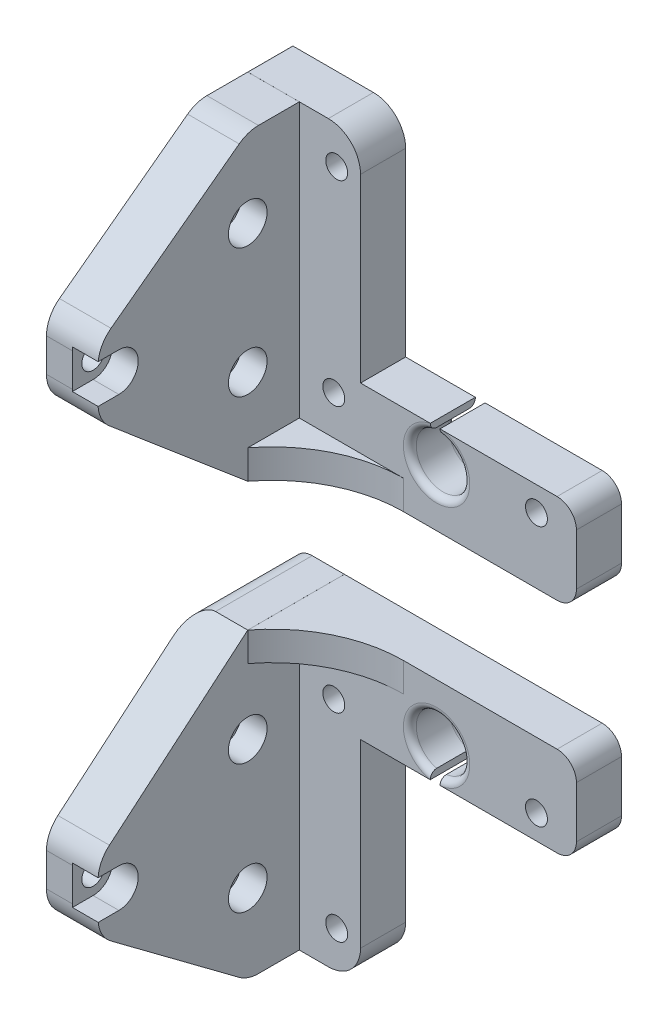
from build123d import *

# Parameters (mm, degrees)
SKETCH50_R         = 1.75
EXTRUDE1_DEPTH     = 8
SKETCH52_R         = 4.15
SKETCH52_R_2       = 1.7
EXTRUDE2_DEPTH     = 7
FILLET1_R          = 3
FILLET2_R          = 5
EXTRUDE3_DEPTH     = 4.5
FILLET4_R          = 5
FILLET5_R          = 3
SKETCH55_R         = 3
CUT_EXTRUDE3_DEPTH = 4
FILLET9_R          = 1
FILLET10_R         = 1
SKETCH57_W         = 1
SKETCH57_H         = 8.155835086
EXTRUDE4_DEPTH     = 4
CUT_EXTRUDE4_START = -7
SKETCH56_W         = 0.996940693
SKETCH56_H         = 2.63977817
CUT_EXTRUDE4_DEPTH = 7.000001


with BuildPart() as part:
    # Sketch50 → Extrude1 (new body)
    with BuildSketch(Plane(origin=(60, 0, 0), x_dir=(0, 0, -1), z_dir=(1, 0, 0))):
        Polygon((-38.234887292, -28), (-38.234887292, -38), (-15, -55.32486375), (0, -55.32486375), (0, -8.32486375), (-15, -8.32486375), align=None)
        with Locations((-35, -33)):
            Circle(SKETCH50_R, mode=Mode.SUBTRACT)
        with Locations((-15, -23)):
            Circle(SKETCH50_R, mode=Mode.SUBTRACT)
        with Locations((-15, -43)):
            Circle(SKETCH50_R, mode=Mode.SUBTRACT)
    extrude(amount=EXTRUDE1_DEPTH)

    # Sketch52 → Extrude2 (add)
    with BuildSketch(Plane(origin=(0, 0, 0), x_dir=(-1, 0, 0), z_dir=(0, 0, -1))):
        Polygon((-60.021067729, -55.328445544), (-60.021067729, -8.328445544), (-111, -8.328445544), (-111, -22.280627193), (-77.5, -22.280627193), (-77.5, -55.328445544), align=None)
        with Locations(Location((-89.299980942, -17.200015896, 0), (0, 0, 90))):
            Circle(SKETCH52_R, mode=Mode.SUBTRACT)
        with Locations(Location((-73.351535893, -18.931266408, 0), (0, 0, 90))):
            Circle(SKETCH52_R_2, mode=Mode.SUBTRACT)
        with Locations(Location((-104.8, -18.5, 0), (0, 0, 90))):
            Circle(SKETCH52_R_2, mode=Mode.SUBTRACT)
        with Locations(Location((-73.801481725, -49.508569042, 0), (0, 0, 90))):
            Circle(SKETCH52_R_2, mode=Mode.SUBTRACT)
    extrude(amount=-EXTRUDE2_DEPTH)

    # Fillet1
    fillet1_edges = [part.edges().sort_by_distance(p)[0] for p in [
        (111, -22.280627193, 3.5),
        (111, -8.328445544, 3.5),
    ]]
    fillet(fillet1_edges, radius=FILLET1_R)

    # Fillet2
    fillet2_edges = [part.edges().sort_by_distance(p)[0] for p in [
        (77.5, -55.328445544, 3.5),
    ]]
    fillet(fillet2_edges, radius=FILLET2_R)

    # Sketch54 → Extrude3 (add)
    with BuildSketch(Plane(origin=(0, -8.328445544, 0), x_dir=(1, 0, 0), z_dir=(0, 1, 0))):
        with BuildLine():
            Line((68, -15), (68, -7))
            Line((68, -7), (84.179453899, -7))
            ThreePointArc((84.179453899, -7), (75.154838555, -9.109252039), (68, -15))
        make_face()
    extrude(amount=-EXTRUDE3_DEPTH)

    # Fillet4
    fillet4_edges = [part.edges().sort_by_distance(p)[0] for p in [
        (64, -55.32486375, 15),
        (64, -38, 38.234887292),
        (64, -28, 38.234887292),
    ]]
    fillet(fillet4_edges, radius=FILLET4_R)

    # Fillet5
    fillet5_edges = [part.edges().sort_by_distance(p)[0] for p in [
        (60, -8.32486375, 7.5),
    ]]
    fillet(fillet5_edges, radius=FILLET5_R)

    # Sketch55 → Cut-Extrude3 (cut)
    with BuildSketch(Plane(origin=(68, 0, 0), x_dir=(0, 0, -1), z_dir=(1, 0, 0))):
        with Locations((-15, -23)):
            Circle(SKETCH55_R)
        with Locations((-15, -43)):
            Circle(SKETCH55_R)
        with BuildLine():
            Line((-35, -30), (-38.787900912, -30))
            Line((-38.787900912, -30), (-38.787900912, -36))
            Line((-38.787900912, -36), (-35, -36))
            ThreePointArc((-35, -36), (-32, -33), (-35, -30))
        make_face()
    extrude(amount=-CUT_EXTRUDE3_DEPTH, mode=Mode.SUBTRACT)

    # Fillet9
    # the kernel refuses this fillet: 1 mm, written as the material it takes off along each edge
    with BuildSketch(Plane(origin=(89.299980942, -17.200015896, 0), x_dir=(0, 1, 0), z_dir=(-1, 0, 0))) as fillet9_piece_1:
        with BuildLine():
            CenterArc((4.15 + FILLET9_R, -FILLET9_R), FILLET9_R, 90, 90)
            Line((4.15, -FILLET9_R), (4.15, 0))
            Line((4.15, 0), (4.15 + FILLET9_R, 0))
        make_face()
    revolve(axis=Axis((89.299980942, -17.200015896, 0), (0, 0, -1)), mode=Mode.SUBTRACT)

    # Fillet10
    # the kernel refuses this fillet: 1 mm, written as the material it takes off along each edge
    with BuildSketch(Plane(origin=(89.299980942, -17.200015896, 7), x_dir=(0, 1, 0), z_dir=(-1, 0, 0))) as fillet10_piece_1:
        with BuildLine():
            CenterArc((4.15 + FILLET10_R, FILLET10_R), FILLET10_R, 180, 90)
            Line((4.15, FILLET10_R), (4.15, 0))
            Line((4.15, 0), (4.15 + FILLET10_R, 0))
        make_face()
    revolve(axis=Axis((89.299980942, -17.200015896, 7), (0, 0, -1)), mode=Mode.SUBTRACT)

    # Sketch57 → Extrude4 (cut)
    with BuildSketch(Plane.XZ.offset(22.280627193)):
        with Locations((89.327585964, 3.449545077)):
            Rectangle(SKETCH57_W, SKETCH57_H)
    extrude(amount=-EXTRUDE4_DEPTH, mode=Mode.SUBTRACT)

    # Sketch56 → Cut-Extrude4 (cut)
    with BuildSketch(Plane(origin=(0, 0, 0), x_dir=(-1, 0, 0), z_dir=(0, 0, -1)).offset(CUT_EXTRUDE4_START)):
        with Locations((-88.818861809, -22.280627193)):
            Rectangle(SKETCH56_W, SKETCH56_H)
    extrude(amount=CUT_EXTRUDE4_DEPTH, mode=Mode.SUBTRACT)


with BuildPart() as body_2:
    # Mirror1: mirrored copy
    add(part.part.mirror(Plane.ZX.offset(1.671554456)))


solid = Compound([part.part, body_2.part])
